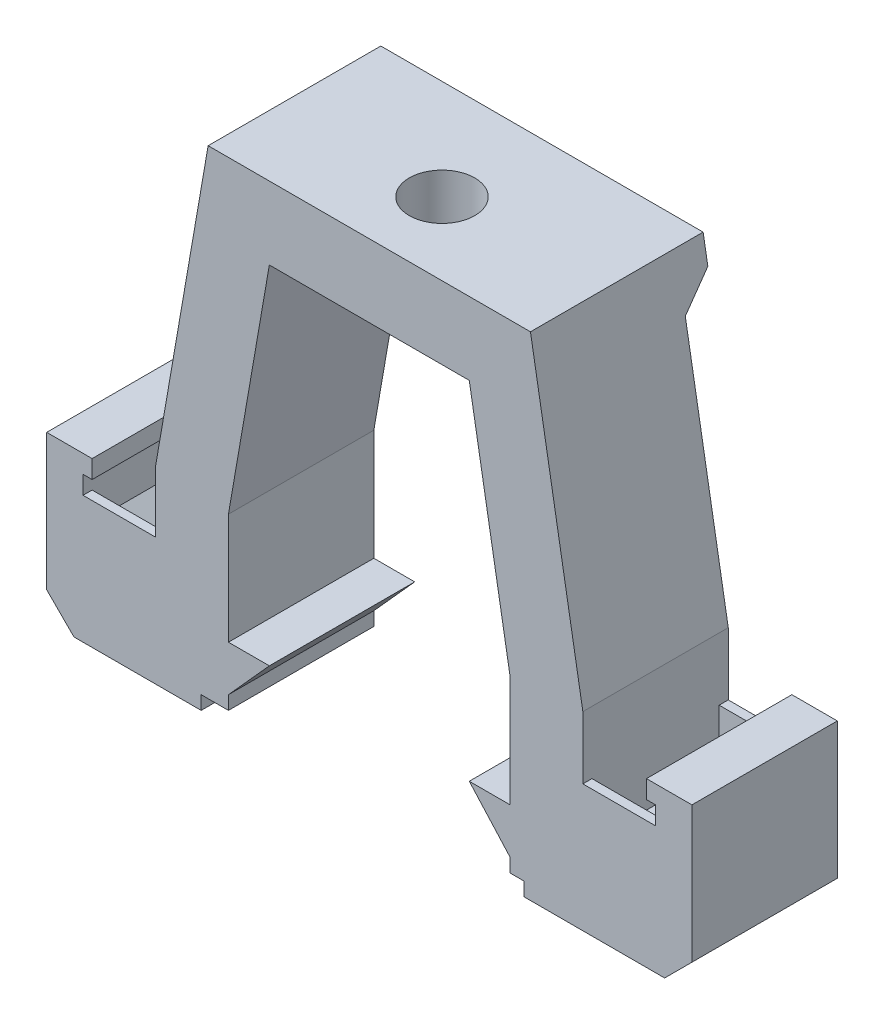
from build123d import *

# Parameters (mm, degrees)
BOSS_EXTRUDE1_DEPTH = 8
SKETCH2_R           = 1.8
CUT_EXTRUDE1_DEPTH  = 31.60183818
BOSS_EXTRUDE4_DEPTH = 8
BOSS_EXTRUDE5_DEPTH = 0.5
BOSS_EXTRUDE6_START = -8
BOSS_EXTRUDE6_DEPTH = 0.5
BOSS_EXTRUDE3_DEPTH = 1.5
CHAMFER3_SIZE       = 1.5


with BuildPart() as part:
    # Sketch1 → Boss-Extrude1 (new body)
    with BuildSketch(Plane.XY):
        Polygon((8.867161478, 0), (-8.867161478, 0), (-11.75, -16.656400352), (-11.75, -27.1), (-9.25, -27.1), (-9.25, -26.35), (-7.75, -26.35), (-7.75, -25.6), (-5.5, -23.1), (-7.75, -23.1), (-7.75, -17), (-5.5, -4), (5.5, -4), (7.75, -17), (7.75, -23.1), (5.5, -23.1), (7.75, -25.6), (7.75, -26.35), (8.5, -26.35), (8.5, -27.1), (11.75, -27.1), (11.75, -16.656400352), align=None)
    extrude(amount=BOSS_EXTRUDE1_DEPTH)

    # Sketch2 → Cut-Extrude1 (cut, through all)
    with BuildSketch(Plane(origin=(0, 0, 0), x_dir=(1, 0, 0), z_dir=(0, 1, 0))):
        with Locations(Location((0, -4, 0), (0, 0, 180))):
            Circle(SKETCH2_R)
    extrude(amount=-CUT_EXTRUDE1_DEPTH, mode=Mode.SUBTRACT)

    # Sketch7 → Boss-Extrude4 (add)
    with BuildSketch(Plane(origin=(0, 0, 0), x_dir=(-1, 0, 0), z_dir=(0, 0, -1))):
        Polygon((-11.75, -27.1), (-16.25, -27.1), (-17.75, -25.6), (-17.75, -18.1), (-15.25, -18.1), (-15.25, -19.1), (-15.75, -19.1), (-15.75, -21.6), (-14.25, -23.1), (-11.75, -23.1), align=None)
        Polygon((16.25, -27.1), (17.75, -25.6), (17.75, -18.1), (15.25, -18.1), (15.25, -19.1), (15.75, -19.1), (15.75, -21.6), (14.25, -23.1), (11.75, -23.1), (11.75, -27.1), align=None)
    extrude(amount=-BOSS_EXTRUDE4_DEPTH)

    # Sketch8 → Boss-Extrude5 (add)
    with BuildSketch(Plane(origin=(0, 0, 0), x_dir=(-1, 0, 0), z_dir=(0, 0, -1))):
        Polygon((-11.75, -23.1), (-11.75, -20.1), (-15.75, -20.1), (-15.75, -21.6), (-14.25, -23.1), align=None)
        Polygon((15.75, -20.1), (11.75, -20.1), (11.75, -23.1), (14.25, -23.1), (15.75, -21.6), align=None)
    extrude(amount=-BOSS_EXTRUDE5_DEPTH)

    # Sketch8<2> → Boss-Extrude6 (add)
    with BuildSketch(Plane(origin=(0, 0, 0), x_dir=(-1, 0, 0), z_dir=(0, 0, -1)).offset(BOSS_EXTRUDE6_START)):
        Polygon((-11.75, -23.1), (-11.75, -20.1), (-15.75, -20.1), (-15.75, -21.6), (-14.25, -23.1), align=None)
        Polygon((15.75, -20.1), (11.75, -20.1), (11.75, -23.1), (14.25, -23.1), (15.75, -21.6), align=None)
    extrude(amount=BOSS_EXTRUDE6_DEPTH)

    # Sketch5 → Boss-Extrude3 (add)
    with BuildSketch(Plane(origin=(0, 0, 0), x_dir=(-1, 0, 0), z_dir=(0, 0, -1))):
        Polygon((8.867161478, 0), (-8.867161478, 0), (-9.126776862, -1.5), (9.126776862, -1.5), align=None)
    extrude(amount=BOSS_EXTRUDE3_DEPTH)

    # Chamfer3
    # the kernel refuses this chamfer: 1.5 mm, written as the material it adds along each edge
    with BuildSketch(Plane(origin=(12.984301344, -1.5, 0), x_dir=(0, -0.9996219169112969, 0.02749587661058638), z_dir=(-1, 0, 0))) as chamfer3_piece_1_section:
        Polygon((CHAMFER3_SIZE * 0.999621916911, -CHAMFER3_SIZE * 0.0274958766106), (-CHAMFER3_SIZE * 0.0274958766106, -CHAMFER3_SIZE * 0.999621916911), (0, 0), align=None)
    chamfer3_piece_1 = extrude(amount=25.968602688, mode=Mode.PRIVATE)
    chamfer3_piece_1 = split(chamfer3_piece_1, bisect_by=Plane(origin=(-8.945746351, -0.454045937, -0.498825905), z_dir=(0.9853505058554479, -0.17054143370575114, 0)), keep=Keep.TOP, mode=Mode.PRIVATE)
    chamfer3_piece_1 = split(chamfer3_piece_1, bisect_by=Plane(origin=(8.945746351, -0.454045937, -0.498825905), z_dir=(-0.9853505058554478, -0.17054143370575137, 0)), keep=Keep.TOP, mode=Mode.PRIVATE)
    add(chamfer3_piece_1)
    # the kernel refuses this chamfer: 1.5 mm, written as the material it takes off along each edge


solid = part.part
